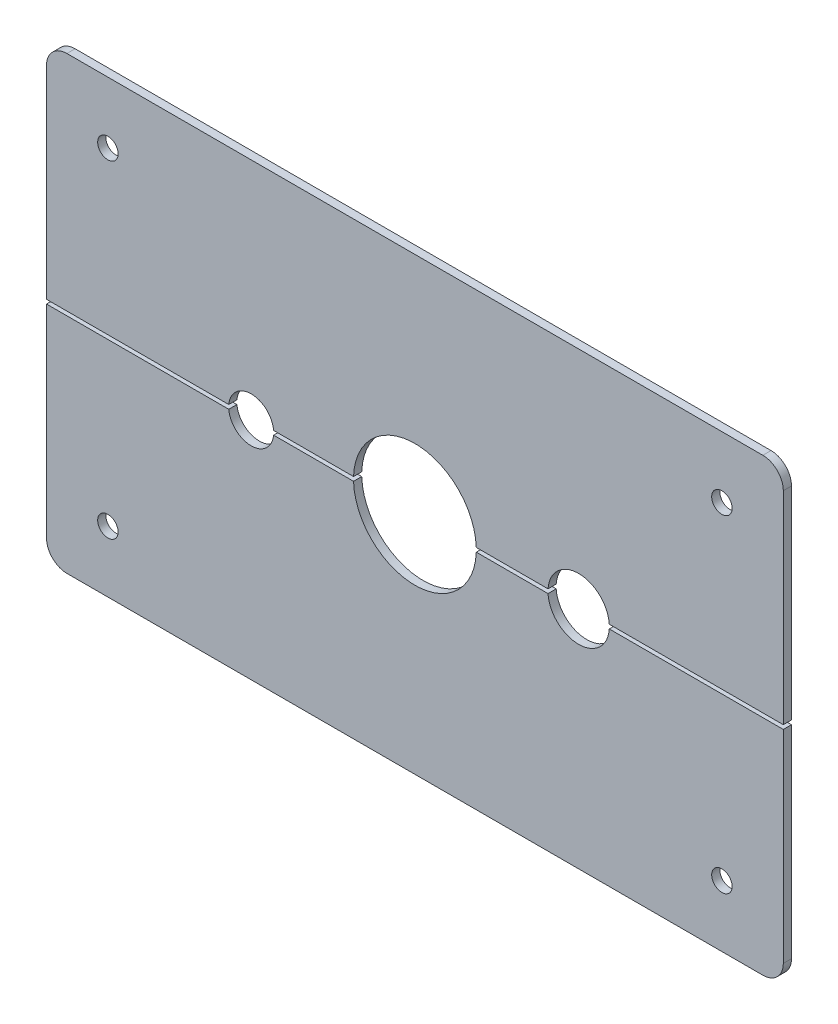
from build123d import *

# Parameters (mm, degrees)
SKETCH_1_W             = 180
SKETCH_1_H             = 110
SM_BASE_FLANGE_1_DEPTH = 2
SKETCH_6_R             = 15
SKETCH_6_R_2           = 5.5
SKETCH_6_R_3           = 7.5
CUT_EXTRUDE_1_DEPTH    = 10
FILLET_1_R             = 5
SKETCH_7_W             = 224.479555932
SKETCH_7_H             = 1
CUT_EXTRUDE_2_DEPTH    = 10
SKETCH_8_R             = 2.5
CUT_EXTRUDE_3_DEPTH    = 10


# Sheet-metal steps are written as plain solids
with BuildPart() as part:
    # Sketch 1 → 基体-法兰1 (new body)
    with BuildSketch(Plane.XY):
        Rectangle(SKETCH_1_W, SKETCH_1_H)
    extrude(amount=-SM_BASE_FLANGE_1_DEPTH)

    # 草图6 → 切除-拉伸1 (cut)
    with BuildSketch(Plane.XY):
        Circle(SKETCH_6_R)
        with Locations((-40, 0)):
            Circle(SKETCH_6_R_2)
        with Locations((40, 0)):
            Circle(SKETCH_6_R_3)
    extrude(amount=-CUT_EXTRUDE_1_DEPTH, mode=Mode.SUBTRACT)

    # 圆角1
    fillet_1_edges = [part.edges().sort_by_distance(p)[0] for p in [
        (-90, 55, -1),
        (90, 55, -1),
        (90, -55, -1),
        (-90, -55, -1),
    ]]
    fillet(fillet_1_edges, radius=FILLET_1_R)

    # 草图7 → 切除-拉伸2 (cut)
    with BuildSketch(Plane.XY):
        Rectangle(SKETCH_7_W, SKETCH_7_H)
    extrude(amount=-CUT_EXTRUDE_2_DEPTH, mode=Mode.SUBTRACT)


with BuildPart() as cut_extrude_2_piece_1:
    # of the separate pieces the step leaves, piece 1, a body of its own (cut_extrude_2_pieces)
    add(part.part.solids().sort_by_distance((85, -55, 0))[0])


with BuildPart() as cut_extrude_2_piece_2:
    # of the separate pieces the step leaves, piece 2, a body of its own (cut_extrude_2_pieces)
    add(part.part.solids().sort_by_distance((90, 50, 0))[0])


with BuildPart() as cut_extrude_3_tool:
    # 草图8 → 切除-拉伸3 (new body)
    with BuildSketch(Plane.XY):
        with Locations((75, 40)):
            Circle(SKETCH_8_R)
        with Locations((-75, 40)):
            Circle(SKETCH_8_R)
        with Locations((-75, -40)):
            Circle(SKETCH_8_R)
        with Locations((75, -40)):
            Circle(SKETCH_8_R)
    extrude(amount=-CUT_EXTRUDE_3_DEPTH)


with BuildPart() as cut_extrude_2_piece_1_1:
    add(cut_extrude_2_piece_1.part)

    # 切除-拉伸3: cut by cut_extrude_3_tool
    add(cut_extrude_3_tool.part, mode=Mode.SUBTRACT)


with BuildPart() as cut_extrude_2_piece_2_1:
    add(cut_extrude_2_piece_2.part)

    # 切除-拉伸3: cut by cut_extrude_3_tool
    add(cut_extrude_3_tool.part, mode=Mode.SUBTRACT)


solid = Compound([cut_extrude_2_piece_1_1.part, cut_extrude_2_piece_2_1.part])
